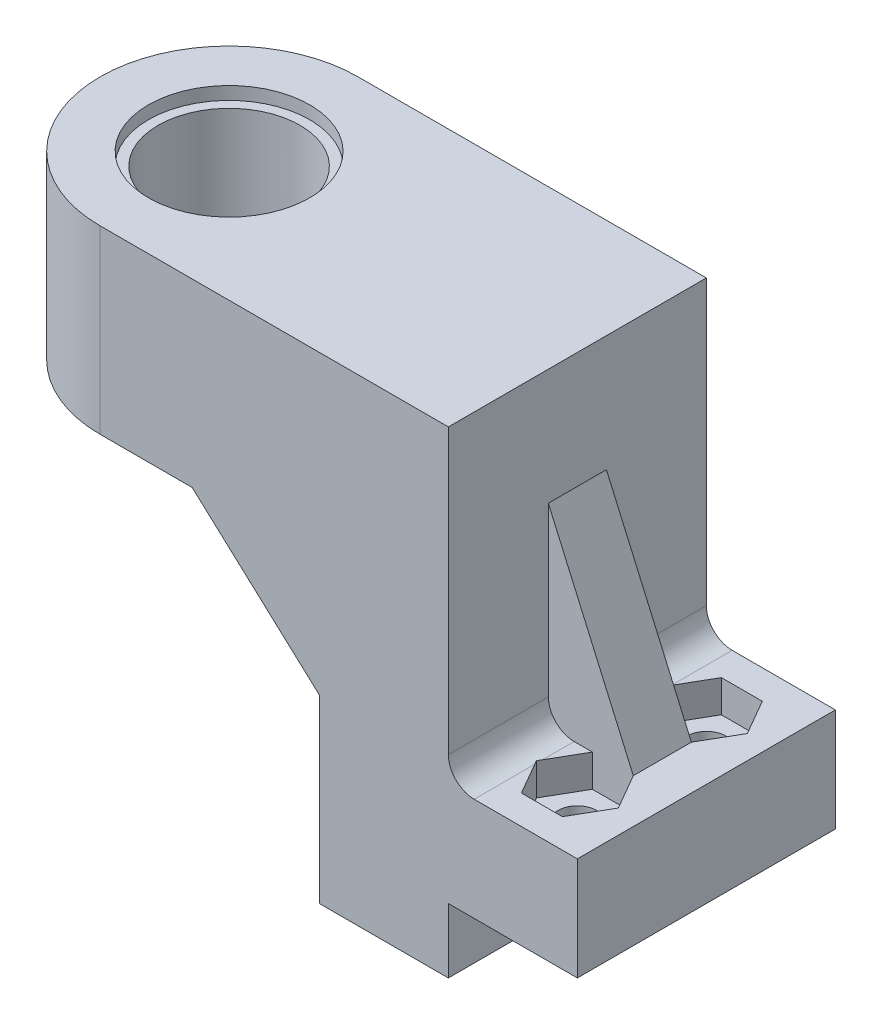
from build123d import *
from build123d.topology import SkipClean

# Parameters (mm, degrees)
EXTRUDE_1_DEPTH           = 20
SKETCH_3_R                = 5.5
CUT_EXTRUDE_2_DEPTH       = 10
SKETCH_9_R                = 6.25
CUT_EXTRUDE_6_DEPTH       = 1
SKETCH_11_W               = 20
SKETCH_11_H               = 5
EXTRUDE_4_DEPTH           = 10
CUT_EXTRUDE_8_REACH       = 78.472
SKETCH_12_R               = 1.5
SKETCH_13_R               = 3
CUT_EXTRUDE_9_DEPTH       = 2.5
SKETCH_14_R               = 10
SKETCH_14_R_2             = 5.5
EXTRUDE_5_DEPTH           = 6
CUT_EXTRUDE_START         = -1
SKETCH_6_R                = 6.25
CUT_EXTRUDE_10_DEPTH      = 1
SKETCH_15_W               = 20
SKETCH_15_H               = 5
EXTRUDE_6_DEPTH           = 5
SKETCH_16_W               = 17
SKETCH_16_H               = 3
EXTRUDE_7_DEPTH           = 15
CUT_EXTRUDE_11_DEPTH      = 70.961190435
CUT_EXTRUDE_11_DEPTH_BACK = 70.961190435
EXTRUDE_START             = -5
SKETCH_3D_3_R             = 1.5
EXTRUDE_8_DEPTH           = 5
CUT_EXTRUDE_12_DEPTH      = 2.5
FILLET_1_R                = 2
CUT_EXTRUDE_14_DEPTH      = 76.06644022
SKETCH_21_W               = 6.587713241
SKETCH_21_H               = 4.5
EXTRUDE_9_DEPTH           = 15
SKETCH_23_W               = 25
SKETCH_23_H               = 20
CUT_EXTRUDE_16_DEPTH      = 5
CUT_EXTRUDE_17_DEPTH      = 10
SKETCH_25_W               = 10
SKETCH_25_H               = 20
EXTRUDE_10_DEPTH          = 3
SKETCH_26_R               = 1.5
CUT_EXTRUDE_18_DEPTH      = 71.326165394
SKETCH_27_R               = 1.5
CUT_EXTRUDE_19_DEPTH      = 71.326165394


with BuildPart() as part:
    # 草图1 → 凸台-拉伸1 (new body)
    with BuildSketch(Plane.XY):
        Polygon((-63.866818046, 22.947717095), (-23.866818046, 22.947717095), (-23.866818046, -19.052282905), (-33.866818046, -19.052282905), (-33.866818046, 14.947717095), (-63.866818046, 14.947717095), align=None)
    extrude(amount=EXTRUDE_1_DEPTH)

    # 草图3 → 切除-拉伸2 (cut)
    with BuildSketch(Plane(origin=(0, 22.947717095, 0), x_dir=(-1, 0, 0), z_dir=(0, 1, 0))):
        with Locations((50.866818046, 10)):
            Circle(SKETCH_3_R)
    extrude(amount=-CUT_EXTRUDE_2_DEPTH, mode=Mode.SUBTRACT)

    # 草图9 → 切除-拉伸6 (cut)
    with BuildSketch(Plane(origin=(0, 22.947717095, 0), x_dir=(1, 0, 0), z_dir=(0, 1, 0))):
        with Locations(Location((-50.866818046, -10, 0), (0, 0, 180))):
            Circle(SKETCH_9_R)
    extrude(amount=-CUT_EXTRUDE_6_DEPTH, mode=Mode.SUBTRACT)

    # 草图11 → 凸台-拉伸4 (add)
    with BuildSketch(Plane(origin=(-23.866818046, 0, 0), x_dir=(0, 0, -1), z_dir=(1, 0, 0))):
        with Locations((-10, -16.552282905)):
            Rectangle(SKETCH_11_W, SKETCH_11_H)
    extrude(amount=EXTRUDE_4_DEPTH)

    # 草图12 → 切除-拉伸8 (cut, up to next)
    with BuildSketch(Plane(origin=(0, -14.052282905, 0), x_dir=(-1, 0, 0), z_dir=(0, 1, 0)), mode=Mode.PRIVATE) as cut_extrude_8_sk1:
        with Locations((18.866818046, 5)):
            Circle(SKETCH_12_R)
    cut_extrude_8_tool1 = extrude(cut_extrude_8_sk1.sketch, amount=-CUT_EXTRUDE_8_REACH, mode=Mode.PRIVATE) & part.part
    # 草图12 → 切除-拉伸8 (cut, up to next)
    with BuildSketch(Plane(origin=(0, -14.052282905, 0), x_dir=(-1, 0, 0), z_dir=(0, 1, 0)), mode=Mode.PRIVATE) as cut_extrude_8_sk2:
        with Locations((18.866818046, 15)):
            Circle(SKETCH_12_R)
    cut_extrude_8_tool2 = extrude(cut_extrude_8_sk2.sketch, amount=-CUT_EXTRUDE_8_REACH, mode=Mode.PRIVATE) & part.part
    add(cut_extrude_8_tool1.solids().sort_by_distance((-18.866818, -14.052283, 5))[0], mode=Mode.SUBTRACT)
    add(cut_extrude_8_tool2.solids().sort_by_distance((-18.866818, -14.052283, 15))[0], mode=Mode.SUBTRACT)

    # 草图13 → 切除-拉伸9 (cut)
    with BuildSketch(Plane.XZ.offset(19.052282905)):
        with Locations(Location((-18.866818046, 15, 0), (0, 0, 270))):
            Circle(SKETCH_13_R)
        with Locations(Location((-18.866818046, 5, 0), (0, 0, 270))):
            Circle(SKETCH_13_R)
    extrude(amount=-CUT_EXTRUDE_9_DEPTH, mode=Mode.SUBTRACT)

    # 草图14 → 凸台-拉伸5 (add)
    with SkipClean():  # the faces are left unmerged after this step: merging them gives an invalid solid
        with BuildSketch(Plane.XZ.offset(-14.947717095)):
            with Locations(Location((-50.866818046, 10, 0), (0, 0, 270))):
                Circle(SKETCH_14_R)
            with Locations(Location((-50.866818046, 10, 0), (0, 0, 180))):
                Circle(SKETCH_14_R_2, mode=Mode.SUBTRACT)
        extrude(amount=EXTRUDE_5_DEPTH)

    # 草图6 → 切除-拉伸10 (cut)
    with BuildSketch(Plane.XZ.offset(-8.947717095).offset(CUT_EXTRUDE_START)):
        with Locations(Location((-50.866818046, 10, 0), (0, 0, 180))):
            Circle(SKETCH_6_R)
    extrude(amount=CUT_EXTRUDE_10_DEPTH, mode=Mode.SUBTRACT)

    # 草图15 → 凸台-拉伸6 (add)
    with BuildSketch(Plane(origin=(-13.866818046, 0, 0), x_dir=(0, 0, -1), z_dir=(1, 0, 0))):
        with Locations((-10, -16.552282905)):
            Rectangle(SKETCH_15_W, SKETCH_15_H)
    extrude(amount=EXTRUDE_6_DEPTH)

    # 草图16 → 凸台-拉伸7 (add)
    with BuildSketch(Plane.XZ.offset(-14.947717095)):
        with Locations((-42.366818046, 18.5)):
            Rectangle(SKETCH_16_W, SKETCH_16_H)
        with Locations((-42.366818046, 1.5)):
            Rectangle(SKETCH_16_W, SKETCH_16_H)
    extrude(amount=EXTRUDE_7_DEPTH)

    # 草图17 → 切除-拉伸11 (cut, two sides: drawn at the far end of the back side and taken through both)
    with BuildSketch(Plane(origin=(0, 0, 17), x_dir=(-1, 0, 0), z_dir=(0, 0, -1)).offset(-CUT_EXTRUDE_11_DEPTH_BACK)):
        Polygon((50.866818046, 8.947717095), (43.725389617, 8.947717095), (33.866818046, -0.052282905), (50.866818046, -0.052282905), align=None)
    extrude(amount=CUT_EXTRUDE_11_DEPTH + CUT_EXTRUDE_11_DEPTH_BACK, mode=Mode.SUBTRACT)

    # Sketch 3D_3 → 凸台-拉伸8 (add)
    with BuildSketch(Plane(origin=(-23.866818046, -6.052282905, 20), x_dir=(0.447213595499958, 0, -0.894427190999916), z_dir=(0, -1, 0)).offset(EXTRUDE_START)):
        Polygon((0, 0), (4.472135955, 8.94427191), (22.360679775, 0), (17.88854382, -8.94427191), align=None)
        with Locations(Location((6.708203932, 2.236067977, 0), (0, 0, 243.434948823))):
            Circle(SKETCH_3D_3_R, mode=Mode.SUBTRACT)
        with Locations(Location((15.652475842, -2.236067977, 0), (0, 0, 243.434948823))):
            Circle(SKETCH_3D_3_R, mode=Mode.SUBTRACT)
    extrude(amount=EXTRUDE_8_DEPTH)

    # 草图18 → 切除-拉伸12 (cut)
    with BuildSketch(Plane(origin=(0, -1.052282905, 0), x_dir=(-1, 0, 0), z_dir=(0, 1, 0))):
        Polygon((15.691391565, 15), (17.279104805, 12.25), (20.454531286, 12.25), (22.042244526, 15), (20.454531286, 17.75), (17.279104805, 17.75), align=None)
        Polygon((15.691391565, 5), (17.279104805, 2.25), (20.454531286, 2.25), (22.042244526, 5), (20.454531286, 7.75), (17.279104805, 7.75), align=None)
    extrude(amount=-CUT_EXTRUDE_12_DEPTH, mode=Mode.SUBTRACT)

    # 圆角1
    # the kernel refuses this fillet: 2 mm, written as the material it adds along each edge
    with BuildSketch(Plane(origin=(-23.866818046, -1.052282905, 0), x_dir=(0, 1, 0), z_dir=(0, 0, 1))) as fillet_1_piece_1_section:
        with BuildLine():
            CenterArc((FILLET_1_R, -FILLET_1_R), FILLET_1_R, 90, 90)
            Line((0, -FILLET_1_R), (0, 0))
            Line((0, 0), (FILLET_1_R, 0))
        make_face()
    fillet_1_piece_1 = extrude(amount=20, mode=Mode.PRIVATE)
    fillet_1_piece_1 = split(fillet_1_piece_1, bisect_by=Plane(origin=(-20.802583542, -0.671658343, 2.852844192), z_dir=(-0.8660254037844387, 0, -0.5000000000000001)), keep=Keep.TOP, mode=Mode.PRIVATE)
    fillet_1_piece_1 = split(fillet_1_piece_1, bisect_by=Plane(origin=(-23.907001975, -0.671658343, 1.770145354), z_dir=(0.8660254037844387, 0, -0.5000000000000003)), keep=Keep.TOP, mode=Mode.PRIVATE)
    add(fillet_1_piece_1)
    with BuildSketch(Plane(origin=(-23.866818046, -1.052282905, 0), x_dir=(0, 1, 0), z_dir=(0, 0, 1))) as fillet_1_piece_2_section:
        with BuildLine():
            CenterArc((FILLET_1_R, -FILLET_1_R), FILLET_1_R, 90, 90)
            Line((0, -FILLET_1_R), (0, 0))
            Line((0, 0), (FILLET_1_R, 0))
        make_face()
    fillet_1_piece_2 = extrude(amount=20, mode=Mode.PRIVATE)
    fillet_1_piece_2 = split(fillet_1_piece_2, bisect_by=Plane(origin=(-22.4188867, -0.519681884, 5.652363381), z_dir=(-0.8660254037844387, 0, -0.5000000000000001)), keep=Keep.TOP, mode=Mode.PRIVATE)
    fillet_1_piece_2 = split(fillet_1_piece_2, bisect_by=Plane(origin=(-22.4188867, -0.519681884, 4.347636619), z_dir=(-0.8660254037844387, 0, 0.5000000000000003)), keep=Keep.TOP, mode=Mode.PRIVATE)
    add(fillet_1_piece_2)
    with BuildSketch(Plane(origin=(-23.866818046, -1.052282905, 0), x_dir=(0, 1, 0), z_dir=(0, 0, 1))) as fillet_1_piece_3_section:
        with BuildLine():
            CenterArc((FILLET_1_R, -FILLET_1_R), FILLET_1_R, 90, 90)
            Line((0, -FILLET_1_R), (0, 0))
            Line((0, 0), (FILLET_1_R, 0))
        make_face()
    fillet_1_piece_3 = extrude(amount=20, mode=Mode.PRIVATE)
    fillet_1_piece_3 = split(fillet_1_piece_3, bisect_by=Plane(origin=(-24.519856268, -0.671658343, 9.291349419), z_dir=(0.8660254037844387, 0, 0.5000000000000001)), keep=Keep.TOP, mode=Mode.PRIVATE)
    fillet_1_piece_3 = split(fillet_1_piece_3, bisect_by=Plane(origin=(-20.189729249, -0.671658343, 8.208650581), z_dir=(-0.8660254037844387, 0, 0.5000000000000003)), keep=Keep.TOP, mode=Mode.PRIVATE)
    fillet_1_piece_3 = split(fillet_1_piece_3, bisect_by=Plane(origin=(-20.189729249, -0.671658343, 11.791349419), z_dir=(-0.8660254037844387, 0, -0.5)), keep=Keep.TOP, mode=Mode.PRIVATE)
    fillet_1_piece_3 = split(fillet_1_piece_3, bisect_by=Plane(origin=(-24.519856268, -0.671658343, 10.708650581), z_dir=(0.8660254037844384, 0, -0.5000000000000004)), keep=Keep.TOP, mode=Mode.PRIVATE)
    add(fillet_1_piece_3)
    with BuildSketch(Plane(origin=(-23.866818046, -1.052282905, 0), x_dir=(0, 1, 0), z_dir=(0, 0, 1))) as fillet_1_piece_4_section:
        with BuildLine():
            CenterArc((FILLET_1_R, -FILLET_1_R), FILLET_1_R, 90, 90)
            Line((0, -FILLET_1_R), (0, 0))
            Line((0, 0), (FILLET_1_R, 0))
        make_face()
    fillet_1_piece_4 = extrude(amount=20, mode=Mode.PRIVATE)
    fillet_1_piece_4 = split(fillet_1_piece_4, bisect_by=Plane(origin=(-22.4188867, -0.519681884, 15.652363381), z_dir=(-0.8660254037844387, 0, -0.5)), keep=Keep.TOP, mode=Mode.PRIVATE)
    fillet_1_piece_4 = split(fillet_1_piece_4, bisect_by=Plane(origin=(-22.4188867, -0.519681884, 14.347636619), z_dir=(-0.8660254037844384, 0, 0.5000000000000004)), keep=Keep.TOP, mode=Mode.PRIVATE)
    add(fillet_1_piece_4)
    with BuildSketch(Plane(origin=(-23.866818046, -1.052282905, 0), x_dir=(0, 1, 0), z_dir=(0, 0, 1))) as fillet_1_piece_5_section:
        with BuildLine():
            CenterArc((FILLET_1_R, -FILLET_1_R), FILLET_1_R, 90, 90)
            Line((0, -FILLET_1_R), (0, 0))
            Line((0, 0), (FILLET_1_R, 0))
        make_face()
    fillet_1_piece_5 = extrude(amount=20, mode=Mode.PRIVATE)
    fillet_1_piece_5 = split(fillet_1_piece_5, bisect_by=Plane(origin=(-23.907001975, -0.671658343, 18.229854646), z_dir=(0.8660254037844387, 0, 0.5)), keep=Keep.TOP, mode=Mode.PRIVATE)
    fillet_1_piece_5 = split(fillet_1_piece_5, bisect_by=Plane(origin=(-20.802583542, -0.671658343, 17.147155808), z_dir=(-0.8660254037844384, 0, 0.5000000000000004)), keep=Keep.TOP, mode=Mode.PRIVATE)
    add(fillet_1_piece_5)

    # 草图20 → 切除-拉伸14 (cut, through all)
    with SkipClean():  # the faces are left unmerged after this step: merging them gives an invalid solid
        with BuildSketch(Plane.XZ.offset(-14.947717095)):
            with BuildLine():
                Line((-63.866818046, 20), (-50.866818046, 20))
                ThreePointArc((-50.866818046, 20), (-60.866818046, 10), (-50.866818046, 0))
                Line((-50.866818046, 0), (-63.866818046, 0))
                Line((-63.866818046, 0), (-63.866818046, 20))
            make_face()
        extrude(amount=-CUT_EXTRUDE_14_DEPTH, mode=Mode.SUBTRACT)
    add(part.part.scale(1), mode=Mode.REPLACE)  # the faces are merged on a copy

    # 草图21 → 凸台-拉伸9 (add)
    with BuildSketch(Plane(origin=(0, -1.052282905, 0), x_dir=(1, 0, 0), z_dir=(0, 1, 0))):
        with Locations((-20.572961426, -10)):
            Rectangle(SKETCH_21_W, SKETCH_21_H)
    extrude(amount=EXTRUDE_9_DEPTH)

    # 草图23 → 切除-拉伸16 (cut)
    with BuildSketch(Plane.XZ.offset(19.052282905)):
        with Locations((-21.366818046, 10)):
            Rectangle(SKETCH_23_W, SKETCH_23_H)
    extrude(amount=-CUT_EXTRUDE_16_DEPTH, mode=Mode.SUBTRACT)

    # 草图24 → 切除-拉伸17 (cut)
    with BuildSketch(Plane.XY.offset(12.25)):
        Polygon((-23.866818046, 13.947717095), (-17.279104805, -1.052282905), (-17.279104805, 13.947717095), align=None)
    extrude(amount=-CUT_EXTRUDE_17_DEPTH, mode=Mode.SUBTRACT)

    # 草图25 → 凸台-拉伸10 (add)
    with BuildSketch(Plane.XZ.offset(6.052282905)):
        with Locations((-18.866818046, 10)):
            Rectangle(SKETCH_25_W, SKETCH_25_H)
    extrude(amount=EXTRUDE_10_DEPTH)

    # 草图26 → 切除-拉伸18 (cut, through all)
    with BuildSketch(Plane(origin=(0, -6.052282905, 0), x_dir=(1, 0, 0), z_dir=(0, 1, 0))):
        with Locations(Location((-18.866818046, -15, 0), (0, 0, 270))):
            Circle(SKETCH_26_R)
    extrude(amount=-CUT_EXTRUDE_18_DEPTH, mode=Mode.SUBTRACT)

    # 草图27 → 切除-拉伸19 (cut, through all)
    with BuildSketch(Plane(origin=(0, -6.052282905, 0), x_dir=(1, 0, 0), z_dir=(0, 1, 0))):
        with Locations(Location((-18.866818046, -5, 0), (0, 0, 270))):
            Circle(SKETCH_27_R)
    extrude(amount=-CUT_EXTRUDE_19_DEPTH, mode=Mode.SUBTRACT)


solid = part.part
